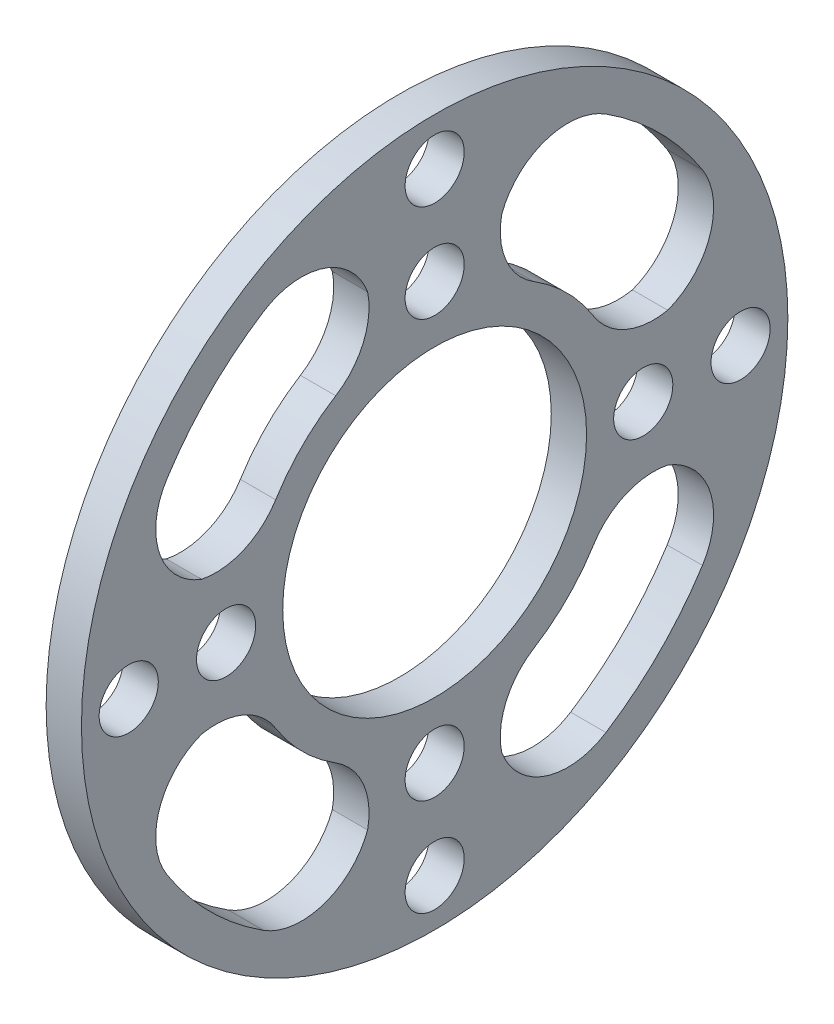
from build123d import *

# Parameters (mm, degrees)
SKETCH1_R           = 25.4
SKETCH1_R_2         = 2.126996
SKETCH1_R_3         = 10.925995089
BOSS_EXTRUDE1_DEPTH = 2.54
FILLET1_R           = 5.08


with BuildPart() as part:
    # Sketch1 → Boss-Extrude1 (new body)
    with BuildSketch(Plane(origin=(0, 0, 0), x_dir=(0, 0, -1), z_dir=(1, 0, 0))):
        Circle(SKETCH1_R)
        with Locations((0, 21.9999941)):
            Circle(SKETCH1_R_2, mode=Mode.SUBTRACT)
        with Locations((14.999999972, 0)):
            Circle(SKETCH1_R_2, mode=Mode.SUBTRACT)
        with Locations((21.9999941, 0)):
            Circle(SKETCH1_R_2, mode=Mode.SUBTRACT)
        with Locations((0, -21.9999941)):
            Circle(SKETCH1_R_2, mode=Mode.SUBTRACT)
        with Locations((-21.9999941, 0)):
            Circle(SKETCH1_R_2, mode=Mode.SUBTRACT)
        with Locations((0, -14.999999972)):
            Circle(SKETCH1_R_2, mode=Mode.SUBTRACT)
        with Locations((-14.999999972, 0)):
            Circle(SKETCH1_R_2, mode=Mode.SUBTRACT)
        with Locations((0, 14.999999972)):
            Circle(SKETCH1_R_2, mode=Mode.SUBTRACT)
        Circle(SKETCH1_R_3, mode=Mode.SUBTRACT)
        with BuildLine():
            Line((12.944345277, 3.71173128), (21.974442369, 6.301069954))
            ThreePointArc((21.974442369, 6.301069954), (16.164461018, 16.164461018), (6.301069954, 21.974442369))
            Line((6.301069954, 21.974442369), (3.71173128, 12.944345277))
            ThreePointArc((3.71173128, 12.944345277), (9.521896443, 9.521896443), (12.944345277, 3.71173128))
        make_face(mode=Mode.SUBTRACT)
        with BuildLine():
            Line((-12.944345277, 3.71173128), (-21.974442369, 6.301069954))
            ThreePointArc((-21.974442369, 6.301069954), (-16.164461018, 16.164461018), (-6.301069954, 21.974442369))
            Line((-6.301069954, 21.974442369), (-3.71173128, 12.944345277))
            ThreePointArc((-3.71173128, 12.944345277), (-9.521896443, 9.521896443), (-12.944345277, 3.71173128))
        make_face(mode=Mode.SUBTRACT)
        with BuildLine():
            Line((3.71173128, -12.944345277), (6.301069954, -21.974442369))
            ThreePointArc((6.301069954, -21.974442369), (16.164461018, -16.164461018), (21.974442369, -6.301069954))
            Line((21.974442369, -6.301069954), (12.944345277, -3.71173128))
            ThreePointArc((12.944345277, -3.71173128), (9.521896443, -9.521896443), (3.71173128, -12.944345277))
        make_face(mode=Mode.SUBTRACT)
        with BuildLine():
            Line((-12.944345277, -3.71173128), (-21.974442369, -6.301069954))
            ThreePointArc((-21.974442369, -6.301069954), (-16.164461018, -16.164461018), (-6.301069954, -21.974442369))
            Line((-6.301069954, -21.974442369), (-3.71173128, -12.944345277))
            ThreePointArc((-3.71173128, -12.944345277), (-9.521896443, -9.521896443), (-12.944345277, -3.71173128))
        make_face(mode=Mode.SUBTRACT)
    extrude(amount=BOSS_EXTRUDE1_DEPTH)

    # Fillet1
    # the kernel refuses this fillet: 5.08 mm, written as the material it adds along each edge
    with BuildSketch(Plane(origin=(0, 6.301069954, -21.974442369), x_dir=(0, 0.911397711724722, 0.41152668329397635), z_dir=(1, 0, 0)), Plane(origin=(0, -21.974442369, -6.301069954), x_dir=(0, 0.4115266832939732, -0.9113977117247234), z_dir=(1, 0, 0)), Plane(origin=(0, -6.301069954, 21.974442369), x_dir=(0, -0.9113977117247248, -0.4115266832939699), z_dir=(1, 0, 0))) as fillet1_piece_1:
        with BuildLine():
            CenterArc((5.867179819, 5.026781091), FILLET1_R, 171.6992252, 106.601549599)
            Line((0.840398727, 5.760178569), (0, 0))
            ThreePointArc((0, 0), (3.300288648, -0.239485089), (6.600577296, 0))
        make_face()
    extrude(amount=2.54)
    with BuildSketch(Plane(origin=(0, 3.71173128, -12.944345277), x_dir=(0, 0.9139096848416328, 0.4059175876365389), z_dir=(1, 0, 0))) as fillet1_piece_2:
        with BuildLine():
            CenterArc((4.426790217, -5.031193515), FILLET1_R, 97.948640691, 74.102718618)
            Line((-0.604403297, -4.328703786), (0, 0))
            ThreePointArc((0, 0), (1.862150244, -0.12937557), (3.724300488, 0))
        make_face()
    extrude(amount=2.54)
    with BuildSketch(Plane(origin=(0, 12.944345277, -3.71173128), x_dir=(0, -0.40591758763655106, -0.9139096848416274), z_dir=(1, 0, 0)), Plane(origin=(0, -12.944345277, 3.71173128), x_dir=(0, 0.4059175876365596, 0.9139096848416237), z_dir=(1, 0, 0)), Plane(origin=(0, 3.71173128, 12.944345277), x_dir=(0, 0.9139096848416286, -0.4059175876365486), z_dir=(1, 0, 0))) as fillet1_piece_3:
        with BuildLine():
            CenterArc((4.426790217, 5.031193515), FILLET1_R, 187.948640691, 74.102718618)
            Line((-0.604403297, 4.328703786), (0, 0))
            ThreePointArc((0, 0), (1.862150244, 0.12937557), (3.724300488, 0))
        make_face()
    extrude(amount=2.54)
    with BuildSketch(Plane(origin=(0, 21.974442369, -6.301069954), x_dir=(0, -0.9612616959383177, 0.275637355817003), z_dir=(1, 0, 0)), Plane(origin=(0, -6.301069954, -21.974442369), x_dir=(0, 0.2756373558170063, 0.9612616959383169), z_dir=(1, 0, 0)), Plane(origin=(0, 6.301069954, 21.974442369), x_dir=(0, -0.27563735581699955, -0.9612616959383188), z_dir=(1, 0, 0))) as fillet1_piece_4:
        with BuildLine():
            CenterArc((5.821162011, 5.08), FILLET1_R, 163.398450401, 106.601549599)
            ThreePointArc((0.952922586, 6.531428571), (0.239485089, 3.300288648), (0, 0))
            Line((0, 0), (5.821162011, 0))
        make_face()
    extrude(amount=2.54)
    with BuildSketch(Plane(origin=(0, -3.71173128, -12.944345277), x_dir=(0, -0.2756373558170063, -0.9612616959383169), z_dir=(1, 0, 0))) as fillet1_piece_5:
        with BuildLine():
            CenterArc((4.370695575, -5.08), FILLET1_R, 90, 74.102718618)
            ThreePointArc((-0.515016307, -3.688518989), (-0.12937557, -1.862150244), (0, 0))
            Line((0, 0), (4.370695575, 0))
        make_face()
    extrude(amount=2.54)
    with BuildSketch(Plane(origin=(0, -12.944345277, -3.71173128), x_dir=(0, -0.9612616959383224, -0.2756373558169866), z_dir=(1, 0, 0)), Plane(origin=(0, -3.71173128, 12.944345277), x_dir=(0, -0.27563735581698295, 0.9612616959383236), z_dir=(1, 0, 0)), Plane(origin=(0, 12.944345277, 3.71173128), x_dir=(0, 0.9612616959383206, 0.2756373558169933), z_dir=(1, 0, 0))) as fillet1_piece_6:
        with BuildLine():
            CenterArc((4.370695575, 5.08), FILLET1_R, 195.897281382, 74.102718618)
            ThreePointArc((-0.515016307, 3.688518989), (-0.12937557, 1.862150244), (0, 0))
            Line((0, 0), (4.370695575, 0))
        make_face()
    extrude(amount=2.54)
    with BuildSketch(Plane(origin=(0, -21.974442369, 6.301069954), x_dir=(0, 0.41152668329399555, 0.9113977117247133), z_dir=(1, 0, 0))) as fillet1_piece_7:
        with BuildLine():
            CenterArc((5.867179819, -5.026781091), FILLET1_R, 81.6992252, 106.601549599)
            Line((0.840398727, -5.760178569), (0, 0))
            ThreePointArc((0, 0), (3.300288648, 0.239485089), (6.600577296, 0))
        make_face()
    extrude(amount=2.54)
    with BuildSketch(Plane(origin=(0, 21.974442369, 6.301069954), x_dir=(0, -0.9612616959383207, -0.27563735581699317), z_dir=(1, 0, 0))) as fillet1_piece_8:
        with BuildLine():
            CenterArc((5.821162011, -5.08), FILLET1_R, 90, 106.601549599)
            ThreePointArc((0.952922586, -6.531428571), (0.239485089, -3.300288648), (0, 0))
            Line((0, 0), (5.821162011, 0))
        make_face()
    extrude(amount=2.54)


solid = part.part
